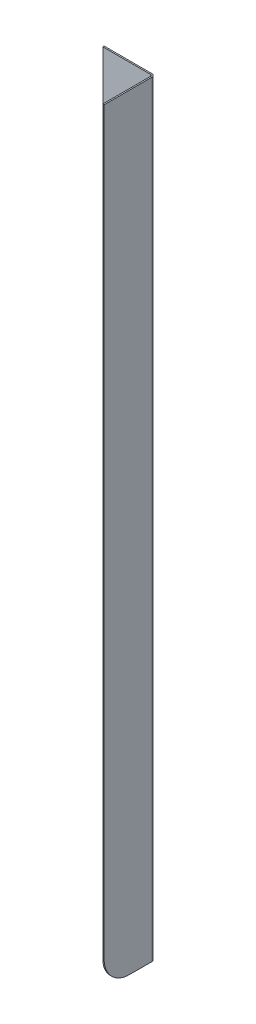
from build123d import *

# Parameters (mm, degrees)
BASE_FLANGE1_DEPTH     = 0.8
SKETCHED_START         = -225
SKETCHED_BEND1_DEPTH   = 450
SKETCHED_BEND1_2_DEPTH = 450
SKETCHED_START_2       = -14.2
SKETCHED_BEND1_3_DEPTH = 16.2


with BuildPart() as part:
    # Base-Flange1: sheet metal written as solids
    # Sketch1 → Base-Flange1 (new body)
    with BuildSketch(Plane.XY):
        with BuildLine():
            Line((-29.2, 225), (29.2, 225))
            Line((29.2, 225), (29.2, -210))
            ThreePointArc((29.2, -210), (24.806601718, -220.606601718), (14.2, -225))
            Line((14.2, -225), (-14.2, -225))
            ThreePointArc((-14.2, -225), (-24.806601718, -220.606601718), (-29.2, -210))
            Line((-29.2, -210), (-29.2, 225))
        make_face()
    extrude(amount=-BASE_FLANGE1_DEPTH)

    # Sketched Bend1: read off the stored shape, not the designer's step
    # Sketched Bend1 outline → Sketched Bend1 (cut)
    with BuildSketch(Plane(origin=(0, 0, 0), x_dir=(1, 0, 0), z_dir=(0, 1, 0)).offset(SKETCHED_START)):
        with BuildLine():
            ThreePointArc((-1.099557429, 0.8), (-0.251029292, 0.587450787), (0.397105525, 0))
            Line((0.397105525, 0), (29.2, 0))
            Line((29.2, 0), (29.2, 0.8))
            Line((29.2, 0.8), (-1.099557429, 0.8))
        make_face()
    extrude(amount=SKETCHED_BEND1_DEPTH, mode=Mode.SUBTRACT)

    # Sketched Bend1 2 outline → Sketched Bend1 2 (add)
    with BuildSketch(Plane(origin=(0, 0, 0), x_dir=(1, 0, 0), z_dir=(0, 1, 0)).offset(SKETCHED_START)):
        with BuildLine():
            Line((0.700442571, -29.100442571), (0.700442571, -1))
            ThreePointArc((0.700442571, -1), (0.622939787, -0.477502784), (0.397105525, 0))
            Line((0.397105525, 0), (-1.099557429, 0))
            ThreePointArc((-1.099557429, 0), (-0.392450648, -0.292893219), (-0.099557429, -1))
            Line((-0.099557429, -1), (-0.099557429, -29.100442571))
            Line((-0.099557429, -29.100442571), (0.700442571, -29.100442571))
        make_face()
    extrude(amount=SKETCHED_BEND1_2_DEPTH)

    # Sketched Bend1 3 outline → Sketched Bend1 3 (cut)
    with BuildSketch(Plane.YZ.offset(SKETCHED_START_2)):
        with BuildLine():
            Line((-225, 29.100442571), (-225, 14.100442571))
            ThreePointArc((-225, 14.100442571), (-220.606601718, 24.707044289), (-210, 29.100442571))
            Line((-210, 29.100442571), (-225, 29.100442571))
        make_face()
    extrude(amount=SKETCHED_BEND1_3_DEPTH, mode=Mode.SUBTRACT)


solid = part.part
